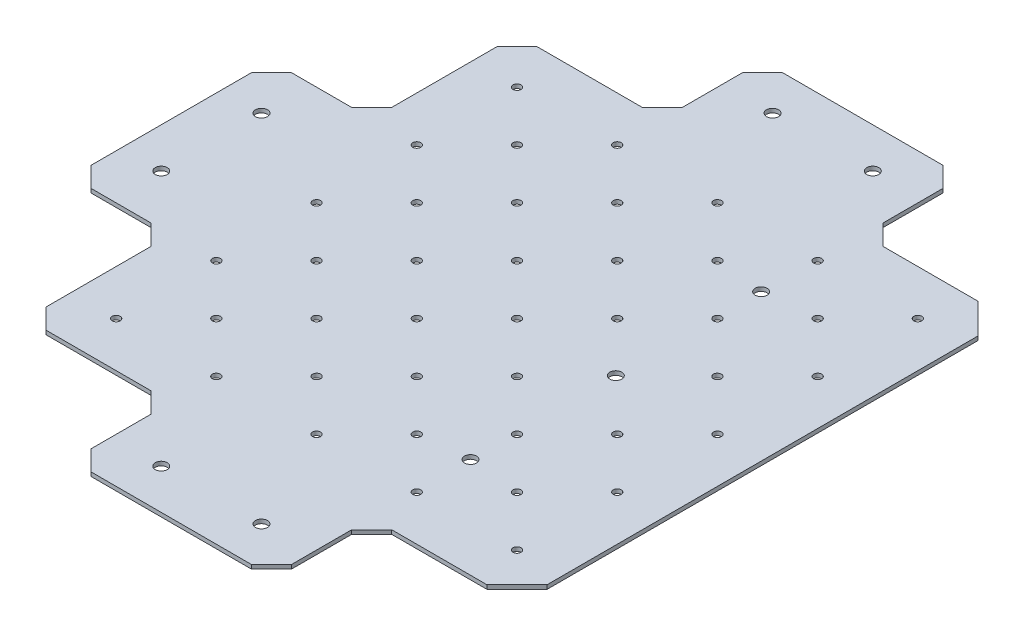
from build123d import *

# Parameters (mm, degrees)
SM_BASE_FLANGE_2_DEPTH = 2
SKETCH_12_R            = 3
CUT_EXTRUDE_2_DEPTH    = 2
SKETCH_13_R            = 3
CUT_EXTRUDE_3_DEPTH    = 2
SKETCH_14_R            = 2
CUT_EXTRUDE_4_DEPTH    = 2
OTHER_START            = -2
OTHER_1_DEPTH          = 2
OTHER_1_2_DEPTH        = 2
OTHER_2_DEPTH          = 2
SKETCH_15_R            = 3
CUT_EXTRUDE_5_DEPTH    = 2


# Read off the part's stored shape, not the designer's step: 断开-边角1, 断开-边角2
# Sheet-metal steps are written as plain solids
with BuildPart() as part:
    # 草图7 → 基体-法兰2 (new body)
    with BuildSketch(Plane(origin=(0, 0, 0), x_dir=(1, 0, 0), z_dir=(0, 1, 0))):
        Polygon((50, 122.5), (122.5, 122.5), (122.5, -122.5), (50, -122.5), (50, -172.5), (-50, -172.5), (-50, -122.5), (-122.5, -122.5), (-122.5, -50), (-172.5, -50), (-172.5, 50), (-122.5, 50), (-122.5, 122.5), (-50, 122.5), (-50, 172.5), (50, 172.5), align=None)
    extrude(amount=-SM_BASE_FLANGE_2_DEPTH)

    # 草图12 → 切除-拉伸2 (cut)
    with BuildSketch(Plane(origin=(0, 0, 0), x_dir=(1, 0, 0), z_dir=(0, 1, 0))):
        with Locations(Location((-152.5, 25, 0), (0, 0, 90))):
            Circle(SKETCH_12_R)
        with Locations(Location((-152.5, -25, 0), (0, 0, 90))):
            Circle(SKETCH_12_R)
        with Locations(Location((-25, -152.5, 0), (0, 0, 90))):
            Circle(SKETCH_12_R)
        with Locations(Location((25, -152.5, 0), (0, 0, 90))):
            Circle(SKETCH_12_R)
        with Locations(Location((-25, 152.5, 0), (0, 0, 90))):
            Circle(SKETCH_12_R)
        with Locations(Location((25, 152.5, 0), (0, 0, 90))):
            Circle(SKETCH_12_R)
    extrude(amount=-CUT_EXTRUDE_2_DEPTH, mode=Mode.SUBTRACT)

    # 草图13 → 切除-拉伸3 (cut)
    with BuildSketch(Plane(origin=(0, 0, 0), x_dir=(1, 0, 0), z_dir=(0, 1, 0))):
        with Locations(Location((49.3, 72.5, 0), (0, 0, 90))):
            Circle(SKETCH_13_R)
        with Locations(Location((49.3, -72.5, 0), (0, 0, 90))):
            Circle(SKETCH_13_R)
    extrude(amount=-CUT_EXTRUDE_3_DEPTH, mode=Mode.SUBTRACT)

    # 草图14 → 切除-拉伸4 (cut)
    with BuildSketch(Plane(origin=(0, 0, 0), x_dir=(1, 0, 0), z_dir=(0, 1, 0))):
        with Locations(Location((-100, 100, 0), (0, 0, 270))):
            Circle(SKETCH_14_R)
        with Locations(Location((-75, 75, 0), (0, 0, 270))):
            Circle(SKETCH_14_R)
        with Locations(Location((-50, 100, 0), (0, 0, 270))):
            Circle(SKETCH_14_R)
        with Locations(Location((0, 100, 0), (0, 0, 270))):
            Circle(SKETCH_14_R)
        with Locations(Location((-25, 75, 0), (0, 0, 270))):
            Circle(SKETCH_14_R)
        with Locations(Location((-50, 50, 0), (0, 0, 270))):
            Circle(SKETCH_14_R)
        with Locations(Location((-100, 50, 0), (0, 0, 270))):
            Circle(SKETCH_14_R)
        with Locations(Location((-75, 25, 0), (0, 0, 270))):
            Circle(SKETCH_14_R)
        with Locations(Location((-100, 0, 0), (0, 0, 270))):
            Circle(SKETCH_14_R)
        with Locations(Location((-50, 0, 0), (0, 0, 270))):
            Circle(SKETCH_14_R)
        with Locations(Location((-25, 25, 0), (0, 0, 270))):
            Circle(SKETCH_14_R)
        with Locations(Location((0, 50, 0), (0, 0, 270))):
            Circle(SKETCH_14_R)
        with Locations(Location((50, 100, 0), (0, 0, 270))):
            Circle(SKETCH_14_R)
        with Locations(Location((100, 100, 0), (0, 0, 270))):
            Circle(SKETCH_14_R)
        with Locations(Location((100, 50, 0), (0, 0, 270))):
            Circle(SKETCH_14_R)
        with Locations(Location((100, 0, 0), (0, 0, 270))):
            Circle(SKETCH_14_R)
        with Locations(Location((100, -50, 0), (0, 0, 270))):
            Circle(SKETCH_14_R)
        with Locations(Location((100, -100, 0), (0, 0, 270))):
            Circle(SKETCH_14_R)
        with Locations(Location((75, -25, 0), (0, 0, 270))):
            Circle(SKETCH_14_R)
        with Locations(Location((75, 25, 0), (0, 0, 270))):
            Circle(SKETCH_14_R)
        with Locations(Location((50, -100, 0), (0, 0, 270))):
            Circle(SKETCH_14_R)
        with Locations(Location((25, 25, 0), (0, 0, 270))):
            Circle(SKETCH_14_R)
        with Locations(Location((25, -25, 0), (0, 0, 270))):
            Circle(SKETCH_14_R)
        with Locations(Location((0, -50, 0), (0, 0, 270))):
            Circle(SKETCH_14_R)
        with Locations(Location((0, 0, 0), (0, 0, 270))):
            Circle(SKETCH_14_R)
        with Locations(Location((0, -100, 0), (0, 0, 270))):
            Circle(SKETCH_14_R)
        with Locations(Location((-25, -75, 0), (0, 0, 270))):
            Circle(SKETCH_14_R)
        with Locations(Location((-25, -25, 0), (0, 0, 270))):
            Circle(SKETCH_14_R)
        with Locations(Location((-75, -25, 0), (0, 0, 270))):
            Circle(SKETCH_14_R)
        with Locations(Location((-75, -75, 0), (0, 0, 270))):
            Circle(SKETCH_14_R)
        with Locations(Location((-50, -50, 0), (0, 0, 270))):
            Circle(SKETCH_14_R)
        with Locations(Location((-50, -100, 0), (0, 0, 270))):
            Circle(SKETCH_14_R)
        with Locations(Location((-100, -50, 0), (0, 0, 270))):
            Circle(SKETCH_14_R)
        with Locations(Location((-100, -100, 0), (0, 0, 270))):
            Circle(SKETCH_14_R)
        with Locations(Location((25, -75, 0), (0, 0, 270))):
            Circle(SKETCH_14_R)
        with Locations(Location((50, -50, 0), (0, 0, 270))):
            Circle(SKETCH_14_R)
        with Locations(Location((25, 75, 0), (0, 0, 270))):
            Circle(SKETCH_14_R)
        with Locations(Location((50, 50, 0), (0, 0, 270))):
            Circle(SKETCH_14_R)
        with Locations(Location((75, 75, 0), (0, 0, 270))):
            Circle(SKETCH_14_R)
        with Locations(Location((75, -75, 0), (0, 0, 270))):
            Circle(SKETCH_14_R)
    extrude(amount=-CUT_EXTRUDE_4_DEPTH, mode=Mode.SUBTRACT)

    # Other 1 outline → Other 1 (cut)
    with BuildSketch(Plane(origin=(0, 0, 0), x_dir=(1, 0, 0), z_dir=(0, 1, 0)).offset(OTHER_START)):
        Polygon((50, 172.5), (40, 172.5), (50, 162.5), align=None)
        Polygon((50, -162.5), (40, -172.5), (50, -172.5), align=None)
        Polygon((-40, -172.5), (-50, -162.5), (-50, -172.5), align=None)
        Polygon((-112.5, -122.5), (-122.5, -112.5), (-122.5, -122.5), align=None)
        Polygon((-162.5, -50), (-172.5, -40), (-172.5, -50), align=None)
        Polygon((-172.5, 40), (-162.5, 50), (-172.5, 50), align=None)
        Polygon((-122.5, 112.5), (-112.5, 122.5), (-122.5, 122.5), align=None)
        Polygon((-50, 162.5), (-40, 172.5), (-50, 172.5), align=None)
    extrude(amount=OTHER_1_DEPTH, mode=Mode.SUBTRACT)

    # Other 1 2 outline → Other 1 2 (add)
    with BuildSketch(Plane(origin=(0, 0, 0), x_dir=(1, 0, 0), z_dir=(0, 1, 0)).offset(OTHER_START)):
        Polygon((60, 122.5), (50, 132.5), (50, 122.5), align=None)
        Polygon((50, -122.5), (50, -132.5), (60, -122.5), align=None)
        Polygon((-50, -122.5), (-60, -122.5), (-50, -132.5), align=None)
        Polygon((-122.5, -50), (-132.5, -50), (-122.5, -60), align=None)
        Polygon((-122.5, 50), (-122.5, 60), (-132.5, 50), align=None)
        Polygon((-50, 122.5), (-50, 132.5), (-60, 122.5), align=None)
    extrude(amount=OTHER_1_2_DEPTH)

    # Other 2 outline → Other 2 (cut)
    with BuildSketch(Plane(origin=(0, 0, 0), x_dir=(1, 0, 0), z_dir=(0, 1, 0)).offset(OTHER_START)):
        Polygon((122.5, 122.5), (107.5, 122.5), (122.5, 107.5), align=None)
        Polygon((122.5, -122.5), (122.5, -107.5), (107.5, -122.5), align=None)
    extrude(amount=OTHER_2_DEPTH, mode=Mode.SUBTRACT)

    # 草图15 → 切除-拉伸5 (cut)
    with BuildSketch(Plane(origin=(0, 0, 0), x_dir=(1, 0, 0), z_dir=(0, 1, 0))):
        with Locations(Location((49.3, 0, 0), (0, 0, 90))):
            Circle(SKETCH_15_R)
    extrude(amount=-CUT_EXTRUDE_5_DEPTH, mode=Mode.SUBTRACT)


solid = part.part
